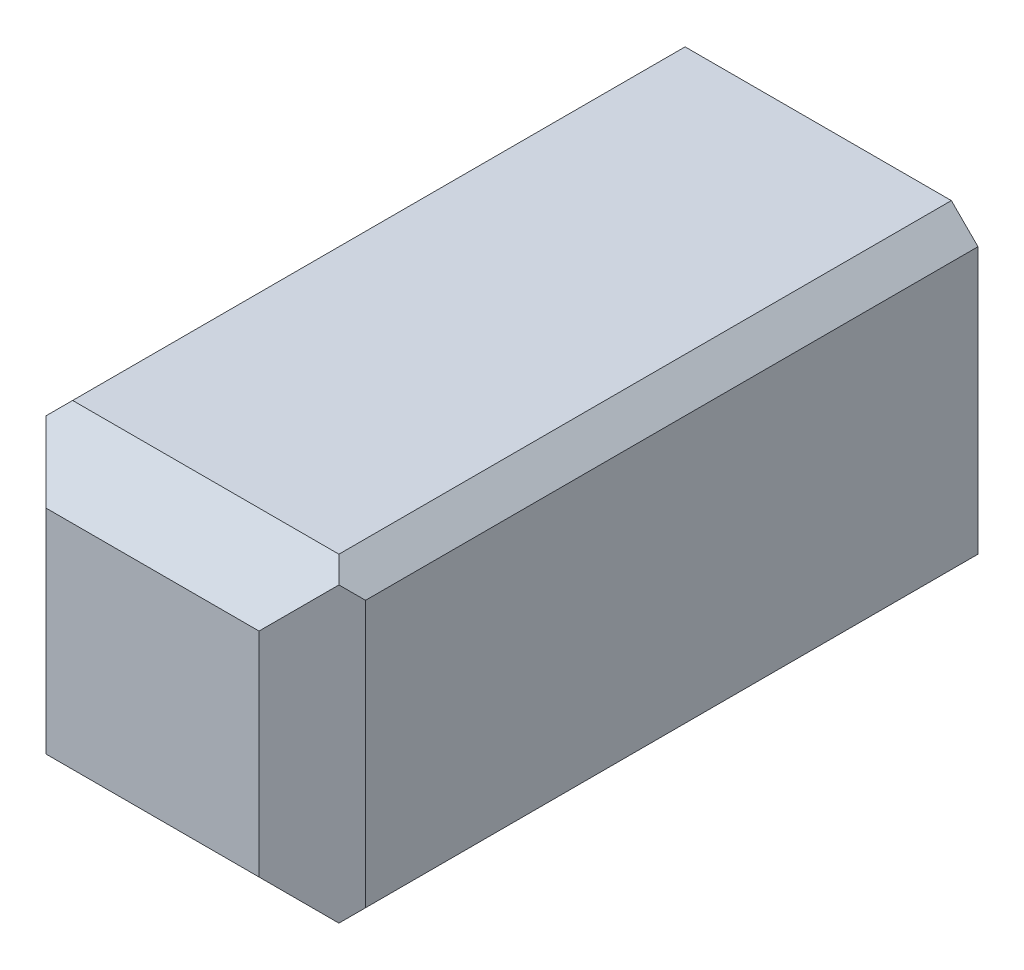
from build123d import *

# Parameters (mm, degrees)
SKETCH2_W           = 24
SKETCH2_H           = 24
BOSS_EXTRUDE2_DEPTH = 50
SKETCH4_R           = 1.4
CUT_EXTRUDE1_DEPTH  = 8
CHAMFER1_SIZE       = 2
CHAMFER2_SIZE       = 4


with BuildPart() as part:
    # Sketch2 → Boss-Extrude2 (new body)
    with BuildSketch(Plane.XY):
        with Locations((12, 12)):
            Rectangle(SKETCH2_W, SKETCH2_H)
    extrude(amount=BOSS_EXTRUDE2_DEPTH)

    # Sketch4 → Cut-Extrude1 (cut)
    with BuildSketch(Plane(origin=(0, 0, 0), x_dir=(-1, 0, 0), z_dir=(0, 0, -1))):
        with Locations((-21, 21)):
            Circle(SKETCH4_R)
        with Locations((-21, 3)):
            Circle(SKETCH4_R)
        with Locations((-3, 3)):
            Circle(SKETCH4_R)
        with Locations((-3, 21)):
            Circle(SKETCH4_R)
    extrude(amount=-CUT_EXTRUDE1_DEPTH, mode=Mode.SUBTRACT)

    # Chamfer1
    chamfer1_edges = [part.edges().sort_by_distance(p)[0] for p in [
        (0, 24, 25),
        (24, 24, 25),
        (24, 0, 25),
        (0, 0, 25),
    ]]
    chamfer(chamfer1_edges, length=CHAMFER1_SIZE)

    # Chamfer2
    # the kernel refuses this chamfer: 4 mm, written as the material it takes off along each edge
    with BuildSketch(Plane(origin=(-8.286731952, 0, 50), x_dir=(0, -0.02749587661058639, -0.9996219169112968), z_dir=(1, 0, 0))) as chamfer2_piece_1:
        Polygon((CHAMFER2_SIZE * 0.999621916911, CHAMFER2_SIZE * 0.0274958766106), (-CHAMFER2_SIZE * 0.0274958766106, CHAMFER2_SIZE * 0.999621916911), (0, 0), align=None)
    extrude(amount=40.573463904, mode=Mode.SUBTRACT)
    with BuildSketch(Plane(origin=(24, -8.286731952, 50), x_dir=(-0.9996219169112968, 0, 0.027495876610585623), z_dir=(0, 1, 0)), Plane(origin=(32.286731952, 24, 50), x_dir=(0, -0.9996219169112968, 0.027495876610585623), z_dir=(-1, 0, 0)), Plane(origin=(0, 32.286731952, 50), x_dir=(0.9996219169112968, 0, 0.02749587661058563), z_dir=(0, -1, 0))) as chamfer2_piece_2:
        Polygon((CHAMFER2_SIZE * 0.999621916911, -CHAMFER2_SIZE * 0.0274958766106), (-CHAMFER2_SIZE * 0.0274958766106, -CHAMFER2_SIZE * 0.999621916911), (0, 0), align=None)
    extrude(amount=40.573463904, mode=Mode.SUBTRACT)


solid = part.part
